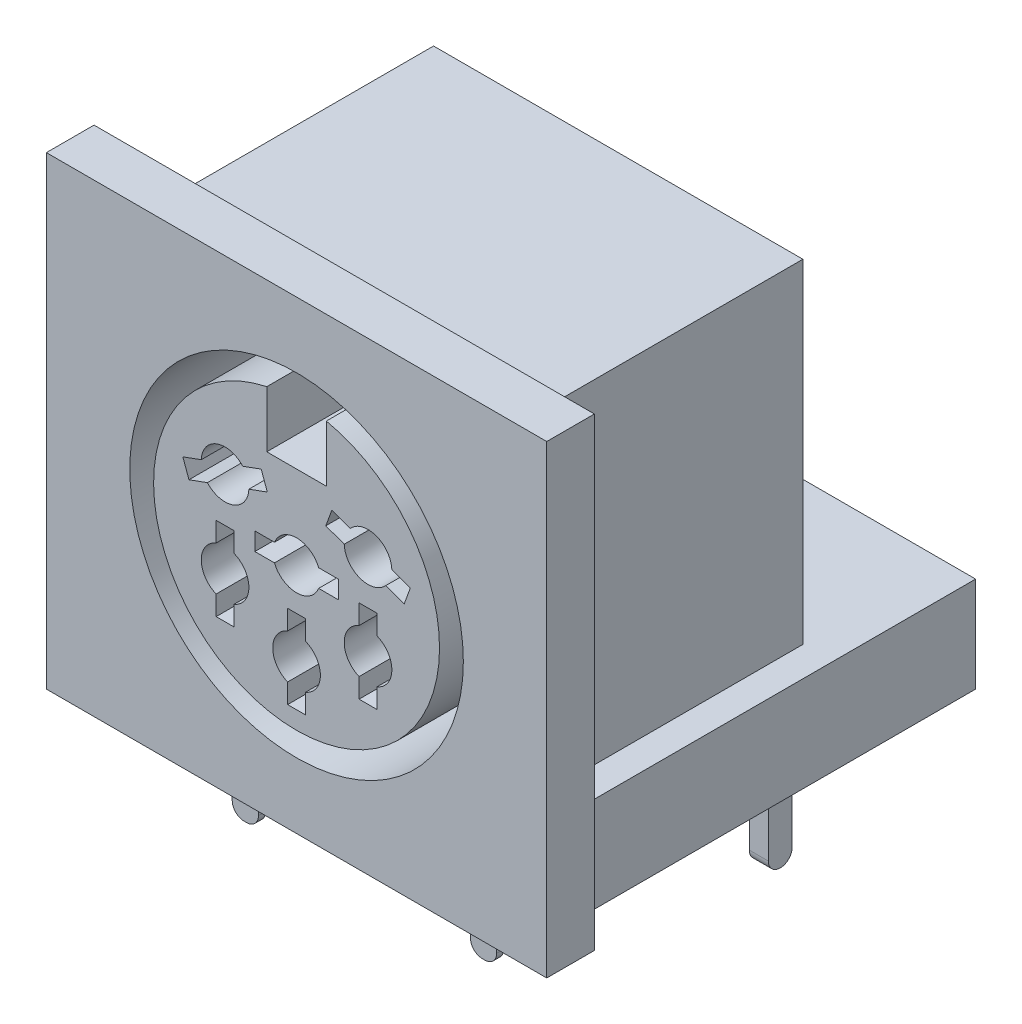
from build123d import *

# Parameters (mm, degrees)
SKETCH_1_W          = 21
SKETCH_1_H          = 19.5
EXTRUDE_1_DEPTH     = 2
SKETCH_3_W          = 15.5
SKETCH_3_H          = 18
EXTRUDE_2_DEPTH     = 13.5
SKETCH_4_W          = 18
SKETCH_4_H          = 4
EXTRUDE_3_DEPTH     = 19.5
SKETCH_2_R          = 7
CUT_EXTRUDE_1_DEPTH = 10
SKETCH_5_R          = 1
CUT_EXTRUDE_2_DEPTH = 10
SKETCH_6_W          = 0.75
SKETCH_6_H          = 3.5
SKETCH_6_W_2        = 3.5
SKETCH_6_H_2        = 0.75
CUT_EXTRUDE_3_DEPTH = 10
SKETCH_7_W          = 1.1
SKETCH_7_H          = 0.3
SKETCH_7_W_2        = 0.8
SKETCH_7_H_2        = 1
SKETCH_7_W_3        = 1
SKETCH_7_H_3        = 0.8
EXTRUDE_4_DEPTH     = 3.5
FILLET_1_R          = 0.5


with BuildPart() as part:
    # Эскиз1 → Бобышка-Вытянуть1 (new body)
    with BuildSketch(Plane.XY):
        with Locations((0, 9.75)):
            Rectangle(SKETCH_1_W, SKETCH_1_H)
    extrude(amount=-EXTRUDE_1_DEPTH)

    # Эскиз3 → Бобышка-Вытянуть2 (add)
    with BuildSketch(Plane.XY):
        with Locations((0, 9)):
            Rectangle(SKETCH_3_W, SKETCH_3_H)
    extrude(amount=-EXTRUDE_2_DEPTH)

    # Эскиз4 → Бобышка-Вытянуть3 (add)
    with BuildSketch(Plane.XY):
        with Locations((0, 2)):
            Rectangle(SKETCH_4_W, SKETCH_4_H)
    extrude(amount=-EXTRUDE_3_DEPTH)

    # Эскиз2 → Вырез-Вытянуть1 (cut)
    with BuildSketch(Plane.XY):
        with Locations((0, 9.75)):
            Circle(SKETCH_2_R)
        with BuildLine():
            Line((-1.25, 15.618347297), (-1.25, 13.25))
            Line((-1.25, 13.25), (1.25, 13.25))
            Line((1.25, 13.25), (1.25, 15.618347297))
            ThreePointArc((1.25, 15.618347297), (0, 3.75), (-1.25, 15.618347297))
        make_face(mode=Mode.SUBTRACT)
    extrude(amount=-CUT_EXTRUDE_1_DEPTH, mode=Mode.SUBTRACT)

    # Эскиз5 → Вырез-Вытянуть2 (cut)
    with BuildSketch(Plane.XY):
        with Locations((0, 6.25)):
            Circle(SKETCH_5_R)
        with Locations((-3, 7.947224362)):
            Circle(SKETCH_5_R)
        with Locations((3, 7.947224362)):
            Circle(SKETCH_5_R)
        with Locations((-3, 11.552775638)):
            Circle(SKETCH_5_R)
        with Locations((3, 11.552775638)):
            Circle(SKETCH_5_R)
        with Locations((0, 9.75)):
            Circle(SKETCH_5_R)
    extrude(amount=-CUT_EXTRUDE_2_DEPTH, mode=Mode.SUBTRACT)

    # Эскиз6 → Вырез-Вытянуть3 (cut)
    with BuildSketch(Plane.XY):
        Polygon((4.516204533, 10.601855654), (1.22728036, 11.798926156), (1.483795467, 12.503695621), (4.77271964, 11.30662512), align=None)
        with Locations((-3, 7.947224362)):
            Rectangle(SKETCH_6_W, SKETCH_6_H)
        with Locations((3, 7.947224362)):
            Rectangle(SKETCH_6_W, SKETCH_6_H)
        with Locations((0, 6.25)):
            Rectangle(SKETCH_6_W, SKETCH_6_H)
        Polygon((-4.516204533, 10.601855654), (-1.22728036, 11.798926156), (-1.483795467, 12.503695621), (-4.77271964, 11.30662512), align=None)
        with Locations((0, 9.75)):
            Rectangle(SKETCH_6_W_2, SKETCH_6_H_2)
    extrude(amount=-CUT_EXTRUDE_3_DEPTH, mode=Mode.SUBTRACT)

    # Эскиз7 → Бобышка-Вытянуть4 (add)
    with BuildSketch(Plane(origin=(0, 0, 0), x_dir=(1, 0, 0), z_dir=(0, 1, 0))):
        with Locations((-5, 3)):
            Rectangle(SKETCH_7_W, SKETCH_7_H)
        with Locations((5, 3)):
            Rectangle(SKETCH_7_W, SKETCH_7_H)
        with Locations((-7.5, 12.4)):
            Rectangle(SKETCH_7_W_2, SKETCH_7_H_2)
        with Locations((0, 12.4)):
            Rectangle(SKETCH_7_W_2, SKETCH_7_H_2)
        with Locations((7.5, 12.4)):
            Rectangle(SKETCH_7_W_2, SKETCH_7_H_2)
        with Locations((-5, 15)):
            Rectangle(SKETCH_7_W_2, SKETCH_7_H_2)
        with Locations((5, 15)):
            Rectangle(SKETCH_7_W_2, SKETCH_7_H_2)
        with Locations((0, 17.3)):
            Rectangle(SKETCH_7_W_3, SKETCH_7_H_3)
    extrude(amount=-EXTRUDE_4_DEPTH)

    # Скругление1
    fillet_1_edges = [part.edges().sort_by_distance(p)[0] for p in [
        (5.55, -3.5, -3),
        (4.45, -3.5, -3),
        (-4.45, -3.5, -3),
        (-5.55, -3.5, -3),
        (0.5, -3.5, -17.3),
        (-0.5, -3.5, -17.3),
        (7.5, -3.5, -12.9),
        (7.5, -3.5, -11.9),
        (5, -3.5, -15.5),
        (5, -3.5, -14.5),
        (0, -3.5, -12.9),
        (0, -3.5, -11.9),
        (-5, -3.5, -14.5),
        (-5, -3.5, -15.5),
        (-7.5, -3.5, -11.9),
        (-7.5, -3.5, -12.9),
    ]]
    fillet(fillet_1_edges, radius=FILLET_1_R - 0.0001)  # a hair under: the kernel refuses the full size


solid = part.part
